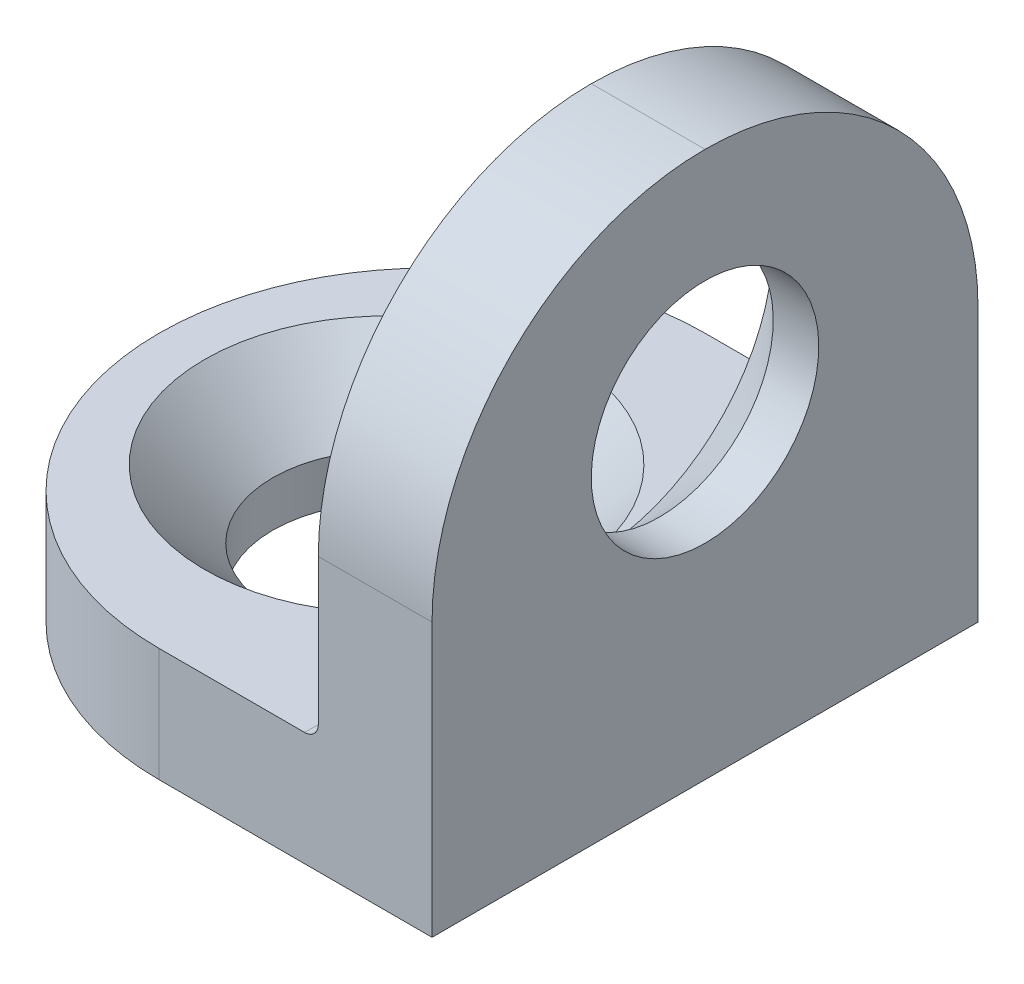
from build123d import *

# Parameters (mm, degrees)
RESSALTO_EXTRUS_O1_DEPTH = 12
FILETE1_R                = 6
FILETE2_R                = 6
ESBO_O3_R                = 2.5
CORTE_EXTRUS_O1_DEPTH    = 20.448650339
FILETE3_R                = 0.3
ESBO_O4_R                = 2.5
CORTE_EXTRUS_O2_DEPTH    = 19.013883535
CHANFRO2_SIZE            = 1.5


with BuildPart() as part:
    # Esboço2 → Ressalto-extrusão1 (new body)
    with BuildSketch(Plane.XY):
        Polygon((0, 0), (0, -2.5), (12, -2.5), (12, 9.5), (9.5, 9.5), (9.5, 0), align=None)
    extrude(amount=-RESSALTO_EXTRUS_O1_DEPTH)

    # Filete1
    filete1_edges = [part.edges().sort_by_distance(p)[0] for p in [
        (10.75, 9.5, 0),
        (10.75, 9.5, -12),
    ]]
    fillet(filete1_edges, radius=FILETE1_R - 0.0001)  # a hair under: the kernel refuses the full size

    # Filete2
    filete2_edges = [part.edges().sort_by_distance(p)[0] for p in [
        (0, -1.25, 0),
        (0, -1.25, -12),
    ]]
    fillet(filete2_edges, radius=FILETE2_R - 0.0001)  # a hair under: the kernel refuses the full size

    # Esboço3 → Corte-extrusão1 (cut, through all)
    with BuildSketch(Plane(origin=(0, 0, 0), x_dir=(1, 0, 0), z_dir=(0, 1, 0))):
        with Locations(Location((5, 6, 0), (0, 0, 180))):
            Circle(ESBO_O3_R)
    extrude(amount=-CORTE_EXTRUS_O1_DEPTH, mode=Mode.SUBTRACT)

    # Filete3
    filete3_edges = [part.edges().sort_by_distance(p)[0] for p in [
        (9.5, 0, -6),
    ]]
    fillet(filete3_edges, radius=FILETE3_R)

    # Esboço4 → Corte-extrusão2 (cut, through all)
    with BuildSketch(Plane.ZY.offset(-9.5)):
        with Locations(Location((-6, 4.5, 0), (0, 0, 270))):
            Circle(ESBO_O4_R)
    extrude(amount=-CORTE_EXTRUS_O2_DEPTH, mode=Mode.SUBTRACT)

    # Chanfro2
    chanfro2_edges = [part.edges().sort_by_distance(p)[0] for p in [
        (7.5, 0, -6),
        (9.5, 7, -6),
    ]]
    chamfer(chanfro2_edges, length=CHANFRO2_SIZE)


solid = part.part
